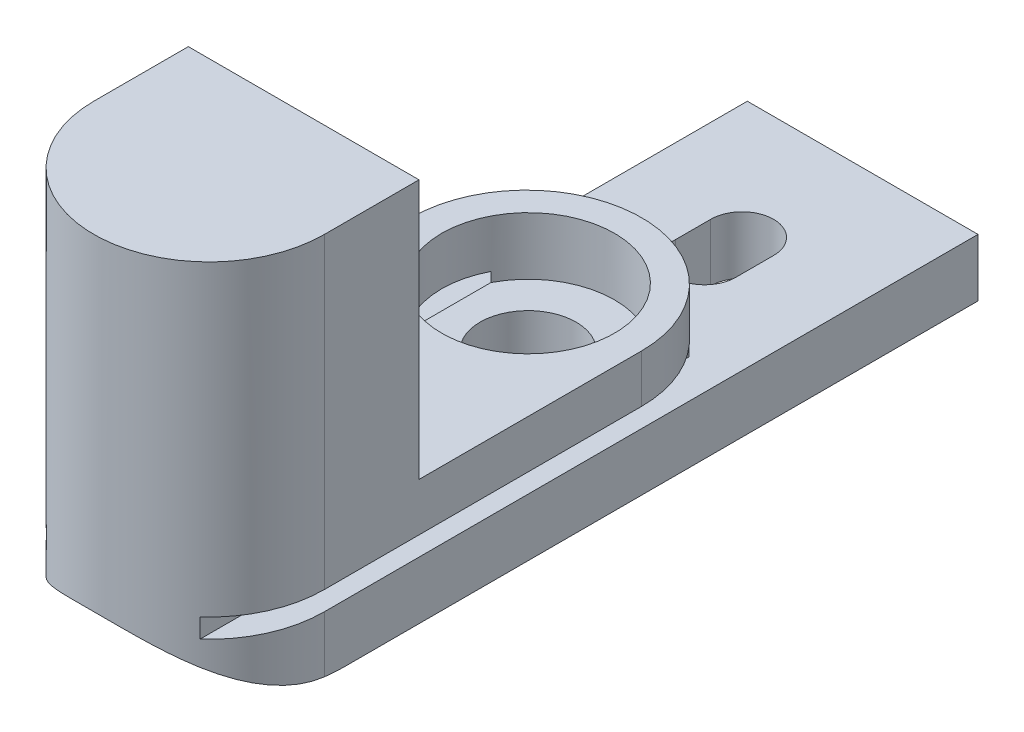
from build123d import *

# Parameters (mm, degrees)
BOSS_EXTRUDE1_DEPTH = 40
CUT_EXTRUDE1_DEPTH  = 35
FILLET1_R           = 10
BOSS_EXTRUDE2_DEPTH = 3.5
CUT_EXTRUDE5_DEPTH  = 41.96687114982433
BOSS_EXTRUDE3_START = 13.5
BOSS_EXTRUDE3_DEPTH = 13.5
SKETCH10_R          = 2.4999999999999996
CUT_EXTRUDE6_DEPTH  = 13.5
SKETCH11_R          = 4.500000000000001
CUT_EXTRUDE7_DEPTH  = 3
SKETCH12_R          = 1.6339869281045687
CUT_EXTRUDE8_DEPTH  = 44.87521560524114
SHELL3_START        = -0.5
SHELL3_DEPTH        = 1
CUT_EXTRUDE9_DEPTH  = 45.47791075024091


# Read off the part's stored shape, not the designer's step: Shell3
with BuildPart() as part:
    # Sketch1 → Boss-Extrude1 (new body)
    with BuildSketch(Plane.XY):
        Polygon((6.0000000000003, 1.5000000000000038), (6.000000000000302, -1.5), (-6.0000000000000036, -1.5000000000000016), (-6.000000000000004, 1.4999999999999993), align=None)
    extrude(amount=BOSS_EXTRUDE1_DEPTH)

    # Sketch3 → Cut-Extrude1 (cut)
    with BuildSketch(Plane(origin=(6.000000000000301, 3.47e-15, 0), x_dir=(0, 0, -1), z_dir=(1, 5.8e-16, 0))):
        Polygon((-40, 1.5000000000000002), (-36.99999999999992, -1.5000000000000036), (-40, -1.5000000000000036), align=None)
    extrude(amount=-CUT_EXTRUDE1_DEPTH, mode=Mode.SUBTRACT)

    # Fillet1
    fillet1_edges = [part.edges().sort_by_distance(p)[0] for p in [
        (1.4921e-13, -1.5000000000000036, 36.99999999999992),
    ]]
    fillet(fillet1_edges, radius=FILLET1_R)

    # Sketch5 → Boss-Extrude2 (add)
    with BuildSketch(Plane(origin=(-5.4e-16, 1.5000000000000016, 0), x_dir=(1, 3.6e-16, 0), z_dir=(-3.6e-16, 1, 0))):
        with BuildLine():
            Line((6.000000000000301, -17.495666027521235), (6.000000000000301, -34.00043164524958))
            ThreePointArc((6.000000000000301, -34.00043164524958), (3.235e-14, -40.00043164524985), (-6.000000000000234, -34.00043164524958))
            Line((-6.000000000000234, -34.00043164524958), (-6.000000000000234, -17.495666027521235))
            ThreePointArc((-6.000000000000234, -17.495666027521235), (3.382e-14, -11.495666027520969), (6.000000000000301, -17.495666027521235))
        make_face()
    extrude(amount=BOSS_EXTRUDE2_DEPTH)

    # Sketch8 → Cut-Extrude5 (cut, through all)
    with BuildSketch(Plane(origin=(-1.81e-15, 5.000000000000002, 0), x_dir=(1, 3.6e-16, 0), z_dir=(-3.6e-16, 1, 0))):
        with BuildLine():
            Line((-6.000000000000004, -40), (-0.07196913699948215, -40))
            ThreePointArc((-0.07196913699948213, -40.00000000000001), (-4.268009771661707, -38.217550636812796), (-6.000000000000242, -34.00043164524961))
            Line((-6.0000000000002425, -34.00043164524961), (-6.000000000000004, -40))
        make_face()
        with BuildLine():
            ThreePointArc((6.000000000000299, -34.00043164524958), (4.268009771661984, -38.217550636812554), (0.07196913700016037, -40))
            Line((0.07196913700015983, -40), (6.000000000000301, -40))
            Line((6.000000000000301, -40), (6.000000000000301, -34.00043164524958))
        make_face()
    extrude(amount=-CUT_EXTRUDE5_DEPTH, mode=Mode.SUBTRACT)

    # Sketch9 → Boss-Extrude3 (add)
    with BuildSketch(Plane(origin=(-1.81e-15, 5.000000000000002, 0), x_dir=(1, 3.6e-16, 0), z_dir=(-3.6e-16, 1, 0)).offset(BOSS_EXTRUDE3_START)):
        with BuildLine():
            Line((-6.000000000000234, -29.081568785258), (6.000000000000301, -29.081568785258))
            Line((6.000000000000301, -29.081568785258), (6.000000000000301, -34.00043164524958))
            ThreePointArc((6.000000000000301, -34.00043164524958), (3.272e-14, -40.00043164524985), (-6.000000000000234, -34.00043164524958))
            Line((-6.000000000000234, -34.00043164524958), (-6.000000000000234, -29.081568785258))
        make_face()
    extrude(amount=-BOSS_EXTRUDE3_DEPTH)

    # Sketch10 → Cut-Extrude6 (cut)
    with BuildSketch(Plane(origin=(-1.81e-15, 5.000000000000002, 0), x_dir=(1, 3.6e-16, 0), z_dir=(-3.6e-16, 1, 0))):
        with Locations(Location((1e-17, -17.403956104439153, 0), (0, 0, 180))):
            Circle(SKETCH10_R)
    extrude(amount=-CUT_EXTRUDE6_DEPTH, mode=Mode.SUBTRACT)

    # Sketch11 → Cut-Extrude7 (cut)
    with BuildSketch(Plane(origin=(-1.81e-15, 5.000000000000002, 0), x_dir=(1, 3.6e-16, 0), z_dir=(-3.6e-16, 1, 0))):
        with Locations(Location((1e-17, -17.403956104439153, 0), (0, 0, 180))):
            Circle(SKETCH11_R)
    extrude(amount=-CUT_EXTRUDE7_DEPTH, mode=Mode.SUBTRACT)

    # Sketch12 → Cut-Extrude8 (cut, through all)
    with BuildSketch(Plane(origin=(-5.4e-16, 1.5000000000000016, 0), x_dir=(1, 3.6e-16, 0), z_dir=(-3.6e-16, 1, 0))):
        with Locations((1e-17, -17.403956104439153)):
            Circle(SKETCH12_R)
        with BuildLine():
            Line((1.6350000000000315, -8.142419448359679), (1.6350000000000313, -6.270656428732565))
            ThreePointArc((1.6350000000000313, -6.270656428732565), (0.00101307189543799, -4.636669500627991), (-1.6329738562091354, -6.270656428732585))
            Line((-1.6329738562091354, -6.270656428732585), (-1.6329738562091352, -8.110833214748085))
            ThreePointArc((-1.6329738562091352, -8.110833214748085), (-0.01582557591703412, -9.86878595405819), (1.6350000000000315, -8.142419448359679))
        make_face()
    extrude(amount=-CUT_EXTRUDE8_DEPTH, mode=Mode.SUBTRACT)

    # Shell3 outline → Shell3 (cut)
    with BuildSketch(Plane.YZ.offset(SHELL3_START)):
        with BuildLine():
            Line((4, 29.081568785), (13, 29.081568785))
            Line((13, 29.081568785), (13, 32.857864376))
            ThreePointArc((13, 32.857864376), (8.5, 37.357864376), (4, 32.857864376))
            Line((4, 32.857864376), (4, 29.081568785))
        make_face()
    extrude(amount=SHELL3_DEPTH, mode=Mode.SUBTRACT)

    # Sketch18 → Cut-Extrude9 (cut, through all)
    with BuildSketch(Plane(origin=(0, 0, 0), x_dir=(-1, 0, 0), z_dir=(0, 0, -1))):
        Polygon((6.000000000000441, 1.5), (6.000000000000442, -1.499999999999904), (-5.999999999999879, -1.4999999999999782), (-5.999999999999879, 1.5000000000000229), (-4.000000000000168, 1.5000000000001654), (-4.000000000000022, 2.5000000000001656), (-7.000000000000024, 2.500000000000053), (-7.000000000000022, -2.499999999999947), (7, -2.4999999999998628), (6.999999999999999, 2.500000000000055), (4.000000000000475, 2.5000000000000546), (4.000000000000459, 1.5), align=None)
    extrude(amount=-CUT_EXTRUDE9_DEPTH, mode=Mode.SUBTRACT)


solid = part.part
